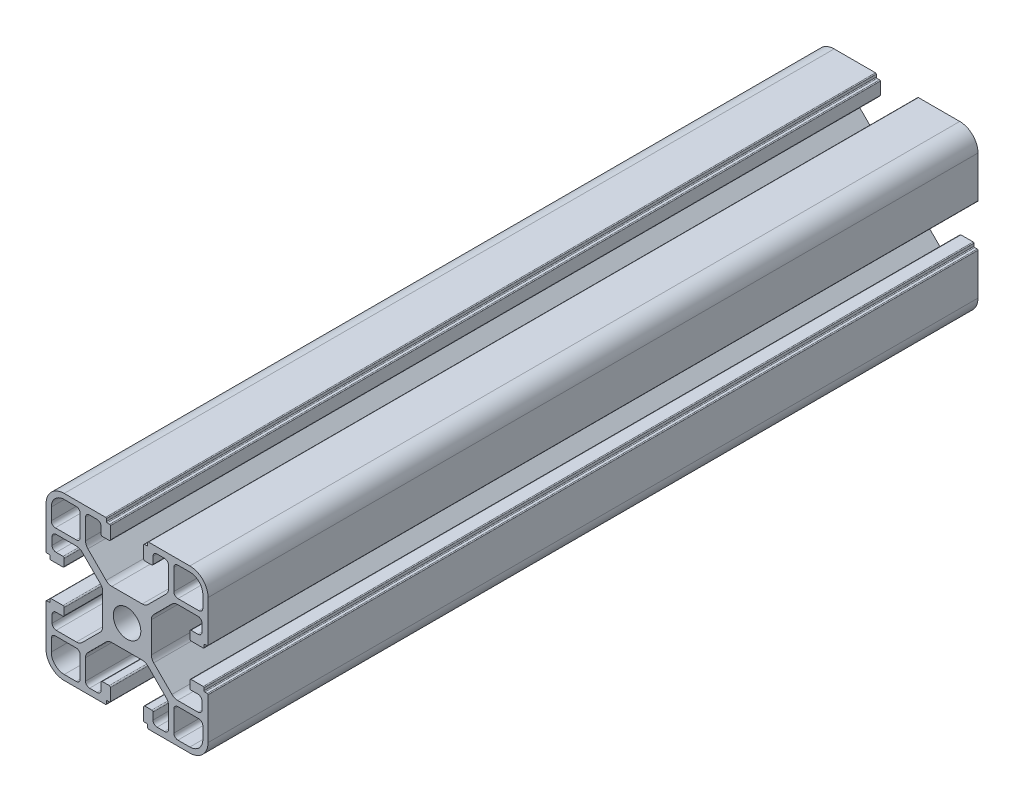
from build123d import *

# Parameters (mm, degrees)
SKETCH2_R           = 3.4
BOSS_EXTRUDE1_DEPTH = 190
SKETCH4_R           = 2.5
CUT_EXTRUDE1_DEPTH  = 199.242276016


with BuildPart() as part:
    # Sketch2 → Boss-Extrude1 (new body)
    with BuildSketch(Plane.XY):
        with BuildLine():
            Line((4.5, 0), (14.7, 0))
            ThreePointArc((14.7, 0), (14.841421356, 0.058578644), (14.9, 0.2))
            Line((14.9, 0.2), (14.9, 0.8))
            ThreePointArc((14.9, 0.8), (14.958578644, 0.941421356), (15.1, 1))
            Line((15.1, 1), (15.7, 1))
            ThreePointArc((15.7, 1), (15.841421356, 1.058578644), (15.9, 1.2))
            Line((15.9, 1.2), (15.9, 4.2))
            ThreePointArc((15.9, 4.2), (15.812132034, 4.412132034), (15.6, 4.5))
            Line((15.6, 4.5), (13.9, 4.5))
            ThreePointArc((13.9, 4.5), (13.687867966, 4.412132034), (13.6, 4.2))
            Line((13.6, 4.2), (13.6, 2.5))
            ThreePointArc((13.6, 2.5), (13.307106781, 1.792893219), (12.6, 1.5))
            Line((12.6, 1.5), (10.75, 1.5))
            ThreePointArc((10.75, 1.5), (10.042893219, 1.792893219), (9.75, 2.5))
            Line((9.75, 2.5), (9.75, 7.507359313))
            ThreePointArc((9.75, 7.507359313), (9.902240935, 8.272726178), (10.335786438, 8.921572875))
            Line((10.335786438, 8.921572875), (14.828427125, 13.414213562))
            ThreePointArc((14.828427125, 13.414213562), (15.477273822, 13.847759065), (16.242640687, 14))
            Line((16.242640687, 14), (23.757359313, 14))
            ThreePointArc((23.757359313, 14), (24.522726178, 13.847759065), (25.171572875, 13.414213562))
            Line((25.171572875, 13.414213562), (29.664213562, 8.921572875))
            ThreePointArc((29.664213562, 8.921572875), (30.097759065, 8.272726178), (30.25, 7.507359313))
            Line((30.25, 7.507359313), (30.25, 2.5))
            ThreePointArc((30.25, 2.5), (29.957106781, 1.792893219), (29.25, 1.5))
            Line((29.25, 1.5), (27.4, 1.5))
            ThreePointArc((27.4, 1.5), (26.692893219, 1.792893219), (26.4, 2.5))
            Line((26.4, 2.5), (26.4, 4.2))
            ThreePointArc((26.4, 4.2), (26.312132034, 4.412132034), (26.1, 4.5))
            Line((26.1, 4.5), (24.4, 4.5))
            ThreePointArc((24.4, 4.5), (24.187867966, 4.412132034), (24.1, 4.2))
            Line((24.1, 4.2), (24.1, 1.2))
            ThreePointArc((24.1, 1.2), (24.158578644, 1.058578644), (24.3, 1))
            Line((24.3, 1), (24.9, 1))
            ThreePointArc((24.9, 1), (25.041421356, 0.941421356), (25.1, 0.8))
            Line((25.1, 0.8), (25.1, 0.2))
            ThreePointArc((25.1, 0.2), (25.158578644, 0.058578644), (25.3, 0))
            Line((25.3, 0), (35.5, 0))
            ThreePointArc((35.5, 0), (38.681980515, 1.318019485), (40, 4.5))
            Line((40, 4.5), (40, 14.7))
            ThreePointArc((40, 14.7), (39.941421356, 14.841421356), (39.8, 14.9))
            Line((39.8, 14.9), (39.2, 14.9))
            ThreePointArc((39.2, 14.9), (39.058578644, 14.958578644), (39, 15.1))
            Line((39, 15.1), (39, 15.7))
            ThreePointArc((39, 15.7), (38.941421356, 15.841421356), (38.8, 15.9))
            Line((38.8, 15.9), (35.8, 15.9))
            ThreePointArc((35.8, 15.9), (35.587867966, 15.812132034), (35.5, 15.6))
            Line((35.5, 15.6), (35.5, 13.9))
            ThreePointArc((35.5, 13.9), (35.587867966, 13.687867966), (35.8, 13.6))
            Line((35.8, 13.6), (37.5, 13.6))
            ThreePointArc((37.5, 13.6), (38.207106781, 13.307106781), (38.5, 12.6))
            Line((38.5, 12.6), (38.5, 10.75))
            ThreePointArc((38.5, 10.75), (38.207106781, 10.042893219), (37.5, 9.75))
            Line((37.5, 9.75), (32.492640687, 9.75))
            ThreePointArc((32.492640687, 9.75), (31.727273822, 9.902240935), (31.078427125, 10.335786438))
            Line((31.078427125, 10.335786438), (26.585786438, 14.828427125))
            ThreePointArc((26.585786438, 14.828427125), (26.152240935, 15.477273822), (26, 16.242640687))
            Line((26, 16.242640687), (26, 23.757359313))
            ThreePointArc((26, 23.757359313), (26.152240935, 24.522726178), (26.585786438, 25.171572875))
            Line((26.585786438, 25.171572875), (31.078427125, 29.664213562))
            ThreePointArc((31.078427125, 29.664213562), (31.727273822, 30.097759065), (32.492640687, 30.25))
            Line((32.492640687, 30.25), (37.5, 30.25))
            ThreePointArc((37.5, 30.25), (38.207106781, 29.957106781), (38.5, 29.25))
            Line((38.5, 29.25), (38.5, 27.4))
            ThreePointArc((38.5, 27.4), (38.207106781, 26.692893219), (37.5, 26.4))
            Line((37.5, 26.4), (35.8, 26.4))
            ThreePointArc((35.8, 26.4), (35.587867966, 26.312132034), (35.5, 26.1))
            Line((35.5, 26.1), (35.5, 24.4))
            ThreePointArc((35.5, 24.4), (35.587867966, 24.187867966), (35.8, 24.1))
            Line((35.8, 24.1), (38.8, 24.1))
            ThreePointArc((38.8, 24.1), (38.941421356, 24.158578644), (39, 24.3))
            Line((39, 24.3), (39, 24.9))
            ThreePointArc((39, 24.9), (39.058578644, 25.041421356), (39.2, 25.1))
            Line((39.2, 25.1), (39.8, 25.1))
            ThreePointArc((39.8, 25.1), (39.941421356, 25.158578644), (40, 25.3))
            Line((40, 25.3), (40, 35.5))
            ThreePointArc((40, 35.5), (38.681980515, 38.681980515), (35.5, 40))
            Line((35.5, 40), (25.3, 40))
            ThreePointArc((25.3, 40), (25.158578644, 39.941421356), (25.1, 39.8))
            Line((25.1, 39.8), (25.1, 39.2))
            ThreePointArc((25.1, 39.2), (25.041421356, 39.058578644), (24.9, 39))
            Line((24.9, 39), (24.3, 39))
            ThreePointArc((24.3, 39), (24.158578644, 38.941421356), (24.1, 38.8))
            Line((24.1, 38.8), (24.1, 35.8))
            ThreePointArc((24.1, 35.8), (24.187867966, 35.587867966), (24.4, 35.5))
            Line((24.4, 35.5), (26.1, 35.5))
            ThreePointArc((26.1, 35.5), (26.312132034, 35.587867966), (26.4, 35.8))
            Line((26.4, 35.8), (26.4, 37.5))
            ThreePointArc((26.4, 37.5), (26.692893219, 38.207106781), (27.4, 38.5))
            Line((27.4, 38.5), (29.25, 38.5))
            ThreePointArc((29.25, 38.5), (29.957106781, 38.207106781), (30.25, 37.5))
            Line((30.25, 37.5), (30.25, 32.492640687))
            ThreePointArc((30.25, 32.492640687), (30.097759065, 31.727273822), (29.664213562, 31.078427125))
            Line((29.664213562, 31.078427125), (25.171572875, 26.585786438))
            ThreePointArc((25.171572875, 26.585786438), (24.522726178, 26.152240935), (23.757359313, 26))
            Line((23.757359313, 26), (16.242640687, 26))
            ThreePointArc((16.242640687, 26), (15.477273822, 26.152240935), (14.828427125, 26.585786438))
            Line((14.828427125, 26.585786438), (10.335786438, 31.078427125))
            ThreePointArc((10.335786438, 31.078427125), (9.902240935, 31.727273822), (9.75, 32.492640687))
            Line((9.75, 32.492640687), (9.75, 37.5))
            ThreePointArc((9.75, 37.5), (10.042893219, 38.207106781), (10.75, 38.5))
            Line((10.75, 38.5), (12.6, 38.5))
            ThreePointArc((12.6, 38.5), (13.307106781, 38.207106781), (13.6, 37.5))
            Line((13.6, 37.5), (13.6, 35.8))
            ThreePointArc((13.6, 35.8), (13.687867966, 35.587867966), (13.9, 35.5))
            Line((13.9, 35.5), (15.6, 35.5))
            ThreePointArc((15.6, 35.5), (15.812132034, 35.587867966), (15.9, 35.8))
            Line((15.9, 35.8), (15.9, 38.8))
            ThreePointArc((15.9, 38.8), (15.841421356, 38.941421356), (15.7, 39))
            Line((15.7, 39), (15.1, 39))
            ThreePointArc((15.1, 39), (14.958578644, 39.058578644), (14.9, 39.2))
            Line((14.9, 39.2), (14.9, 39.8))
            ThreePointArc((14.9, 39.8), (14.841421356, 39.941421356), (14.7, 40))
            Line((14.7, 40), (4.5, 40))
            ThreePointArc((4.5, 40), (1.318019485, 38.681980515), (0, 35.5))
            Line((0, 35.5), (0, 25.3))
            ThreePointArc((0, 25.3), (0.058578644, 25.158578644), (0.2, 25.1))
            Line((0.2, 25.1), (0.8, 25.1))
            ThreePointArc((0.8, 25.1), (0.941421356, 25.041421356), (1, 24.9))
            Line((1, 24.9), (1, 24.3))
            ThreePointArc((1, 24.3), (1.058578644, 24.158578644), (1.2, 24.1))
            Line((1.2, 24.1), (4.2, 24.1))
            ThreePointArc((4.2, 24.1), (4.412132034, 24.187867966), (4.5, 24.4))
            Line((4.5, 24.4), (4.5, 26.1))
            ThreePointArc((4.5, 26.1), (4.412132034, 26.312132034), (4.2, 26.4))
            Line((4.2, 26.4), (2.5, 26.4))
            ThreePointArc((2.5, 26.4), (1.792893219, 26.692893219), (1.5, 27.4))
            Line((1.5, 27.4), (1.5, 29.25))
            ThreePointArc((1.5, 29.25), (1.792893219, 29.957106781), (2.5, 30.25))
            Line((2.5, 30.25), (7.507359313, 30.25))
            ThreePointArc((7.507359313, 30.25), (8.272726178, 30.097759065), (8.921572875, 29.664213562))
            Line((8.921572875, 29.664213562), (13.414213562, 25.171572875))
            ThreePointArc((13.414213562, 25.171572875), (13.847759065, 24.522726178), (14, 23.757359313))
            Line((14, 23.757359313), (14, 16.242640687))
            ThreePointArc((14, 16.242640687), (13.847759065, 15.477273822), (13.414213562, 14.828427125))
            Line((13.414213562, 14.828427125), (8.921572875, 10.335786438))
            ThreePointArc((8.921572875, 10.335786438), (8.272726178, 9.902240935), (7.507359313, 9.75))
            Line((7.507359313, 9.75), (2.5, 9.75))
            ThreePointArc((2.5, 9.75), (1.792893219, 10.042893219), (1.5, 10.75))
            Line((1.5, 10.75), (1.5, 12.6))
            ThreePointArc((1.5, 12.6), (1.792893219, 13.307106781), (2.5, 13.6))
            Line((2.5, 13.6), (4.2, 13.6))
            ThreePointArc((4.2, 13.6), (4.412132034, 13.687867966), (4.5, 13.9))
            Line((4.5, 13.9), (4.5, 15.6))
            ThreePointArc((4.5, 15.6), (4.412132034, 15.812132034), (4.2, 15.9))
            Line((4.2, 15.9), (1.2, 15.9))
            ThreePointArc((1.2, 15.9), (1.058578644, 15.841421356), (1, 15.7))
            Line((1, 15.7), (1, 15.1))
            ThreePointArc((1, 15.1), (0.941421356, 14.958578644), (0.8, 14.9))
            Line((0.8, 14.9), (0.2, 14.9))
            ThreePointArc((0.2, 14.9), (0.058578644, 14.841421356), (0, 14.7))
            Line((0, 14.7), (0, 4.5))
            ThreePointArc((0, 4.5), (1.318019485, 1.318019485), (4.5, 0))
        make_face()
        with Locations((20, 20)):
            Circle(SKETCH2_R, mode=Mode.SUBTRACT)
        with BuildLine():
            Line((31.55, 37.7), (31.55, 32.55))
            ThreePointArc((31.55, 32.55), (31.842893219, 31.842893219), (32.55, 31.55))
            Line((32.55, 31.55), (37.7, 31.55))
            ThreePointArc((37.7, 31.55), (38.407106781, 31.842893219), (38.7, 32.55))
            Line((38.7, 32.55), (38.7, 35.5))
            ThreePointArc((38.7, 35.5), (37.7627417, 37.7627417), (35.5, 38.7))
            Line((35.5, 38.7), (32.55, 38.7))
            ThreePointArc((32.55, 38.7), (31.842893219, 38.407106781), (31.55, 37.7))
        make_face(mode=Mode.SUBTRACT)
        with BuildLine():
            Line((1.3, 35.5), (1.3, 32.55))
            ThreePointArc((1.3, 32.55), (1.592893219, 31.842893219), (2.3, 31.55))
            Line((2.3, 31.55), (7.45, 31.55))
            ThreePointArc((7.45, 31.55), (8.157106781, 31.842893219), (8.45, 32.55))
            Line((8.45, 32.55), (8.45, 37.7))
            ThreePointArc((8.45, 37.7), (8.157106781, 38.407106781), (7.45, 38.7))
            Line((7.45, 38.7), (4.5, 38.7))
            ThreePointArc((4.5, 38.7), (2.2372583, 37.7627417), (1.3, 35.5))
        make_face(mode=Mode.SUBTRACT)
        with BuildLine():
            Line((1.3, 7.45), (1.3, 4.5))
            ThreePointArc((1.3, 4.5), (2.2372583, 2.2372583), (4.5, 1.3))
            Line((4.5, 1.3), (7.45, 1.3))
            ThreePointArc((7.45, 1.3), (8.157106781, 1.592893219), (8.45, 2.3))
            Line((8.45, 2.3), (8.45, 7.45))
            ThreePointArc((8.45, 7.45), (8.157106781, 8.157106781), (7.45, 8.45))
            Line((7.45, 8.45), (2.3, 8.45))
            ThreePointArc((2.3, 8.45), (1.592893219, 8.157106781), (1.3, 7.45))
        make_face(mode=Mode.SUBTRACT)
        with BuildLine():
            Line((31.55, 7.45), (31.55, 2.3))
            ThreePointArc((31.55, 2.3), (31.842893219, 1.592893219), (32.55, 1.3))
            Line((32.55, 1.3), (35.5, 1.3))
            ThreePointArc((35.5, 1.3), (37.7627417, 2.2372583), (38.7, 4.5))
            Line((38.7, 4.5), (38.7, 7.45))
            ThreePointArc((38.7, 7.45), (38.407106781, 8.157106781), (37.7, 8.45))
            Line((37.7, 8.45), (32.55, 8.45))
            ThreePointArc((32.55, 8.45), (31.842893219, 8.157106781), (31.55, 7.45))
        make_face(mode=Mode.SUBTRACT)
    extrude(amount=BOSS_EXTRUDE1_DEPTH)

    # Sketch4 → Cut-Extrude1 (cut, through all)
    with BuildSketch(Plane.ZY):
        with Locations((15, 20)):
            Circle(SKETCH4_R)
        with Locations((68, 20)):
            Circle(SKETCH4_R)
    extrude(amount=-CUT_EXTRUDE1_DEPTH, mode=Mode.SUBTRACT)


solid = part.part
